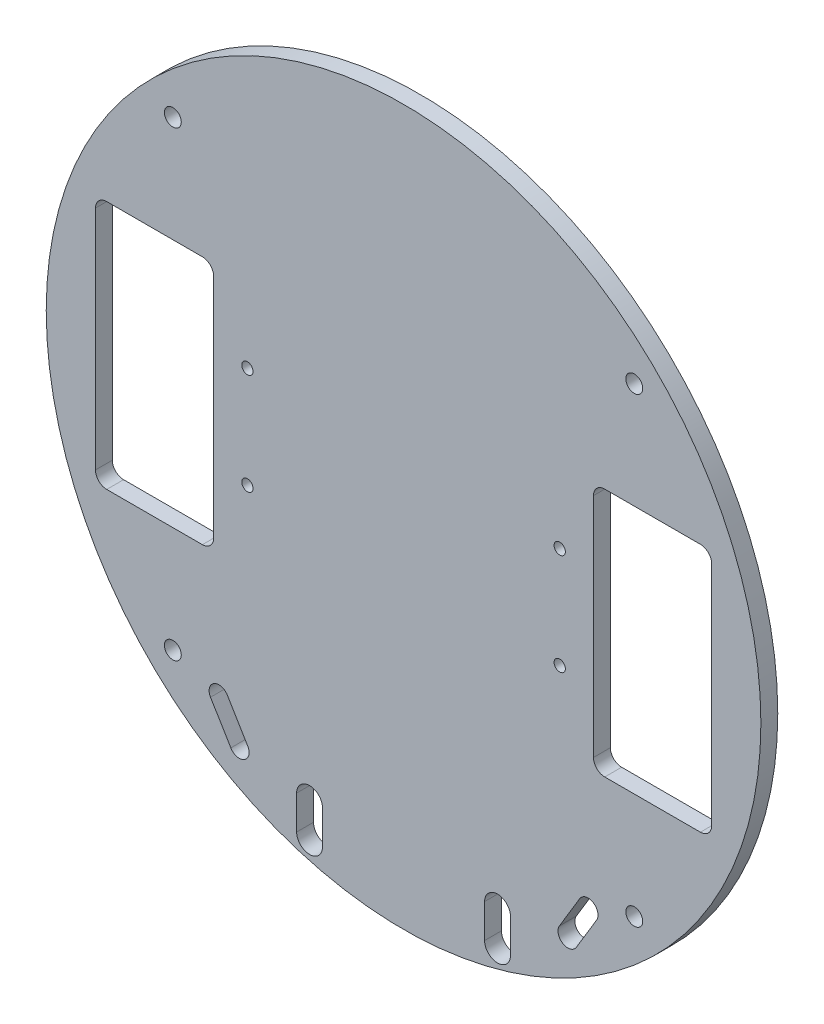
from build123d import *

# Parameters (mm, degrees)
BOSS_EXTRUDE1_OUTLINE_R   = 63.5
BOSS_EXTRUDE1_OUTLINE_R_2 = 1.5
BOSS_EXTRUDE1_OUTLINE_R_3 = 1
BOSS_EXTRUDE1_OUTLINE_W   = 21
BOSS_EXTRUDE1_OUTLINE_H   = 44.3
BOSS_EXTRUDE1_DEPTH       = 3
FILLET1_R                 = 2


# Read off the part's stored shape, not the designer's step: Boss-Extrude1
with BuildPart() as part:
    # Boss-Extrude1 outline → Boss-Extrude1 (new body)
    with BuildSketch(Plane.XY):
        Circle(BOSS_EXTRUDE1_OUTLINE_R)
        with Locations((-41, -41)):
            Circle(BOSS_EXTRUDE1_OUTLINE_R_2, mode=Mode.SUBTRACT)
        with BuildLine():
            Line((-19, -58), (-19, -52))
            ThreePointArc((-19, -52), (-16.7, -49.7), (-14.4, -52))
            Line((-14.4, -52), (-14.4, -58))
            ThreePointArc((-14.4, -58), (-16.7, -60.3), (-19, -58))
        make_face(mode=Mode.SUBTRACT)
        with BuildLine():
            Line((-30.697224362, -50.901387819), (-34.302775638, -44.901387819))
            ThreePointArc((-34.302775638, -44.901387819), (-33.704163457, -42.5), (-31.302775638, -43.098612181))
            Line((-31.302775638, -43.098612181), (-27.697224362, -49.098612181))
            ThreePointArc((-27.697224362, -49.098612181), (-28.295836543, -51.5), (-30.697224362, -50.901387819))
        make_face(mode=Mode.SUBTRACT)
        with Locations((-27.75, -9)):
            Circle(BOSS_EXTRUDE1_OUTLINE_R_3, mode=Mode.SUBTRACT)
        with BuildLine():
            Line((14.4, -58), (14.4, -52))
            ThreePointArc((14.4, -52), (16.7, -49.7), (19, -52))
            Line((19, -52), (19, -58))
            ThreePointArc((19, -58), (16.7, -60.3), (14.4, -58))
        make_face(mode=Mode.SUBTRACT)
        with BuildLine():
            Line((34.302775638, -44.901387819), (30.697224362, -50.901387819))
            ThreePointArc((30.697224362, -50.901387819), (28.295836543, -51.5), (27.697224362, -49.098612181))
            Line((27.697224362, -49.098612181), (31.302775638, -43.098612181))
            ThreePointArc((31.302775638, -43.098612181), (33.704163457, -42.5), (34.302775638, -44.901387819))
        make_face(mode=Mode.SUBTRACT)
        with Locations((41, -41)):
            Circle(BOSS_EXTRUDE1_OUTLINE_R_2, mode=Mode.SUBTRACT)
        with Locations((27.75, -9)):
            Circle(BOSS_EXTRUDE1_OUTLINE_R_3, mode=Mode.SUBTRACT)
        with Locations((-44.25, 0)):
            Rectangle(BOSS_EXTRUDE1_OUTLINE_W, BOSS_EXTRUDE1_OUTLINE_H, mode=Mode.SUBTRACT)
        with Locations((-27.75, 9)):
            Circle(BOSS_EXTRUDE1_OUTLINE_R_3, mode=Mode.SUBTRACT)
        with Locations((-41, 41)):
            Circle(BOSS_EXTRUDE1_OUTLINE_R_2, mode=Mode.SUBTRACT)
        with Locations((27.75, 9)):
            Circle(BOSS_EXTRUDE1_OUTLINE_R_3, mode=Mode.SUBTRACT)
        with Locations((44.25, 0)):
            Rectangle(BOSS_EXTRUDE1_OUTLINE_W, BOSS_EXTRUDE1_OUTLINE_H, mode=Mode.SUBTRACT)
        with Locations((41, 41)):
            Circle(BOSS_EXTRUDE1_OUTLINE_R_2, mode=Mode.SUBTRACT)
    extrude(amount=BOSS_EXTRUDE1_DEPTH)

    # Fillet1
    fillet1_edges = [part.edges().sort_by_distance(p)[0] for p in [
        (-54.75, 22.15, 1.5),
        (-54.75, -22.15, 1.5),
        (-33.75, -22.15, 1.5),
        (-33.75, 22.15, 1.5),
        (33.75, 22.15, 1.5),
        (33.75, -22.15, 1.5),
        (54.75, -22.15, 1.5),
        (54.75, 22.15, 1.5),
    ]]
    fillet(fillet1_edges, radius=FILLET1_R)


solid = part.part
